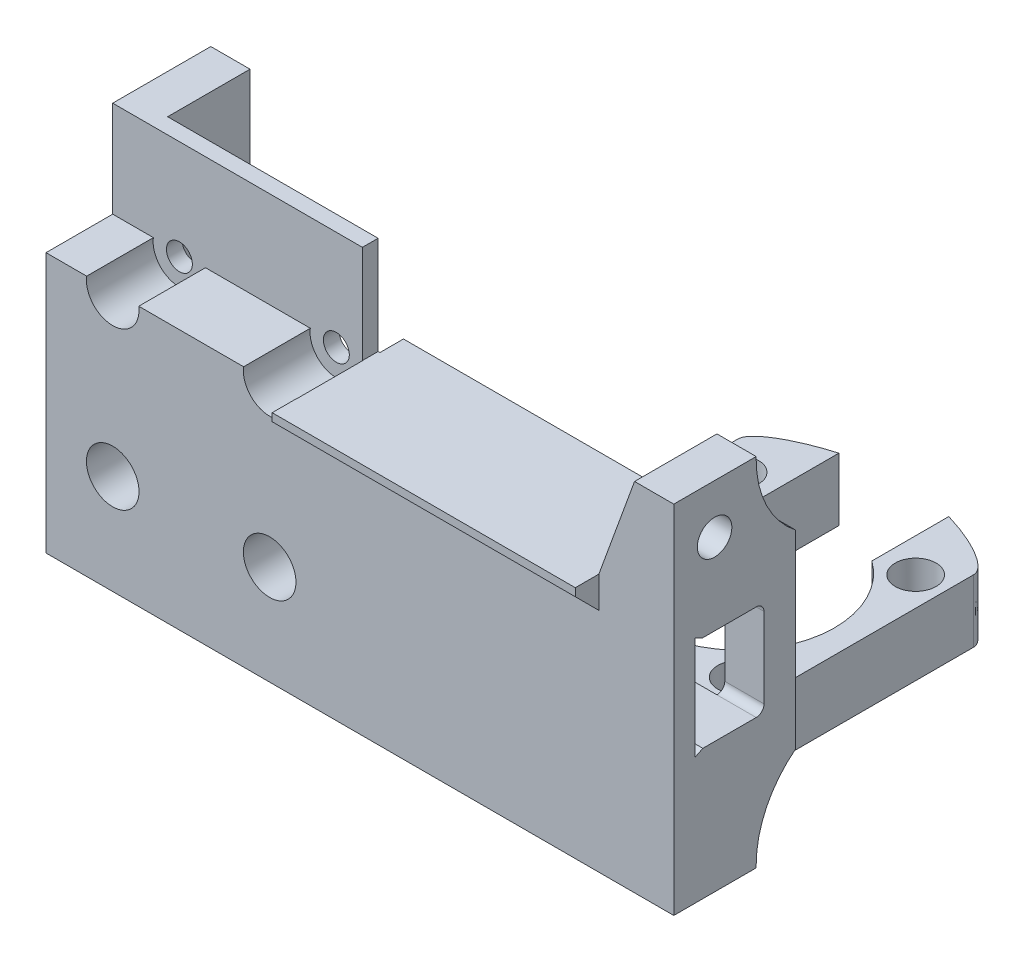
from build123d import *

# Parameters (mm, degrees)
SKETCH1_W               = 80
SKETCH1_H               = 45.4
SKETCH1_R               = 1.65
BOSS_EXTRUDE1_DEPTH     = 10.5
SKETCH2_W               = 5
SKETCH2_H               = 45.4
BOSS_EXTRUDE2_DEPTH     = 10.5
CUT_EXTRUDE1_DEPTH      = 7.8
CUT_EXTRUDE1_DEPTH_BACK = 93.58190968
SKETCH3_W               = 80
SKETCH3_H               = 12.2
SKETCH4_W               = 30
SKETCH4_H               = 8
BOSS_EXTRUDE3_DEPTH     = 44.2
SKETCH5_R               = 12
CUT_EXTRUDE2_DEPTH      = 45
CUT_EXTRUDE3_DEPTH      = 96.828388278
CUT_EXTRUDE3_DEPTH_BACK = 96.828388278
SKETCH6_R               = 2.6
FILLET1_SIZE            = 6
FILLET1_SIZE_2          = 15
SKETCH8_R               = 3.35
CUT_EXTRUDE5_DEPTH      = 8.5
SKETCH12_W              = 45
SKETCH12_H              = 12.25
CUT_EXTRUDE8_DEPTH      = 8.5
SKETCH13_W              = 14
SKETCH13_H              = 23.274164218
CUT_EXTRUDE10_DEPTH     = 10
SKETCH15_R              = 2.75
BOSS_EXTRUDE6_DEPTH     = 2
SKETCH16_W              = 43.180372268
SKETCH16_H              = 10.5
CUT_EXTRUDE11_DEPTH     = 12.5
CHAMFER2_SIZE2          = 12.5
CHAMFER2_SIZE           = 4.549627928
SKETCH17_R              = 2.2
CUT_EXTRUDE12_DEPTH     = 10
CUT_EXTRUDE13_DEPTH     = 102.559280367
SKETCH19_W              = 5
SKETCH19_H              = 24.2
BOSS_EXTRUDE7_DEPTH     = 5
SKETCH20_W              = 1
SKETCH20_H              = 12.2
CUT_EXTRUDE14_DEPTH     = 102.559280367
SKETCH21_W              = 5
SKETCH21_H              = 9.5
BOSS_EXTRUDE8_DEPTH     = 12.2
FILLET2_R               = 1
FILLET3_R               = 13
CHAMFER1_SIZE           = 2
SKETCH22_W              = 38.63074434
SKETCH22_H              = 1
BOSS_EXTRUDE9_DEPTH     = 3
SKETCH23_W              = 38.4
SKETCH23_H              = 1
BOSS_EXTRUDE10_DEPTH    = 3
CHAMFER3_SIZE           = 3


# Some blends are built 0.0001 mm under size
with BuildPart() as part:
    # Sketch1 → Boss-Extrude1 (new body)
    with BuildSketch(Plane.XY):
        with Locations((40, 22.7)):
            Rectangle(SKETCH1_W, SKETCH1_H)
        with Locations(Location((8.499989197, 32.7, 0), (0, 0, 180))):
            Circle(SKETCH1_R, mode=Mode.SUBTRACT)
        with Locations(Location((28.499989197, 32.7, 0), (0, 0, 180))):
            Circle(SKETCH1_R, mode=Mode.SUBTRACT)
        with Locations(Location((28.499989197, 12.7, 0), (0, 0, 180))):
            Circle(SKETCH1_R, mode=Mode.SUBTRACT)
        with Locations(Location((8.499989197, 12.7, 0), (0, 0, 180))):
            Circle(SKETCH1_R, mode=Mode.SUBTRACT)
    extrude(amount=BOSS_EXTRUDE1_DEPTH)

    # Sketch2 → Boss-Extrude2 (add)
    with BuildSketch(Plane(origin=(0, 0, 0), x_dir=(-1, 0, 0), z_dir=(0, 0, -1))):
        with Locations((-2.5, 22.7)):
            Rectangle(SKETCH2_W, SKETCH2_H)
    extrude(amount=BOSS_EXTRUDE2_DEPTH)

    # Sketch3 → Cut-Extrude1 (cut, two sides: drawn at the far end of the back side and taken through both)
    with BuildSketch(Plane.XY.offset(-CUT_EXTRUDE1_DEPTH_BACK)):
        with Locations((40, 22.7)):
            Rectangle(SKETCH3_W, SKETCH3_H)
    extrude(amount=CUT_EXTRUDE1_DEPTH + CUT_EXTRUDE1_DEPTH_BACK, mode=Mode.SUBTRACT)

    # Sketch4 → Boss-Extrude3 (add)
    with BuildSketch(Plane(origin=(0, 0, 0), x_dir=(-1, 0, 0), z_dir=(0, 0, -1))):
        with Locations((-54.5, 4)):
            Rectangle(SKETCH4_W, SKETCH4_H)
    extrude(amount=BOSS_EXTRUDE3_DEPTH)

    # Sketch5 → Cut-Extrude2 (cut)
    with BuildSketch(Plane(origin=(0, 8, 0), x_dir=(1, 0, 0), z_dir=(0, 1, 0))):
        with Locations(Location((54.495569327, 23.5, 0), (0, 0, 270))):
            Circle(SKETCH5_R)
    extrude(amount=-CUT_EXTRUDE2_DEPTH, mode=Mode.SUBTRACT)

    # Sketch6 → Cut-Extrude3 (cut, two sides: drawn at the far end of the back side and taken through both)
    with BuildSketch(Plane.XZ.offset(-16.6).offset(-CUT_EXTRUDE3_DEPTH_BACK)):
        with Locations((54.495569327, -39.201340103)):
            Circle(SKETCH6_R)
        with Locations((65.809277826, -34.515048602)):
            Circle(SKETCH6_R)
        with Locations((43.181860828, -34.515048602)):
            Circle(SKETCH6_R)
        with Locations((43.181860828, -11.887631605)):
            Circle(SKETCH6_R)
        with Locations((65.809277826, -11.887631605)):
            Circle(SKETCH6_R)
    extrude(amount=CUT_EXTRUDE3_DEPTH + CUT_EXTRUDE3_DEPTH_BACK, mode=Mode.SUBTRACT)

    # Fillet1
    # a fillet whose section is not a circle: 15, 6 mm, written as the material it takes off along each edge
    with BuildSketch(Plane(origin=(39.5, -37.5, -44.2), x_dir=(0, 0, 1), z_dir=(0, 1, 0)), Plane(origin=(69.5, 45.5, -44.2), x_dir=(0, 0, 1), z_dir=(0, -1, 0))) as fillet1_piece_1:
        with BuildLine():
            Bezier((FILLET1_SIZE, 0), (0, 0), (0, FILLET1_SIZE_2), weights=[1, 0.428571429, 1])
            Line((0, FILLET1_SIZE_2), (0, 0))
            Line((0, 0), (FILLET1_SIZE, 0))
        make_face()
    extrude(amount=83, mode=Mode.SUBTRACT)

    # Sketch8 → Cut-Extrude5 (cut)
    with BuildSketch(Plane.XY.offset(10.5)):
        with Locations((8.499989197, 32.7)):
            Circle(SKETCH8_R)
        with Locations((28.499989197, 32.7)):
            Circle(SKETCH8_R)
        with Locations((8.499989197, 12.7)):
            Circle(SKETCH8_R)
        with Locations((28.499989197, 12.7)):
            Circle(SKETCH8_R)
    extrude(amount=-CUT_EXTRUDE5_DEPTH, mode=Mode.SUBTRACT)

    # Sketch12 → Cut-Extrude8 (cut)
    with BuildSketch(Plane.XY.offset(10.5)):
        with Locations((22.5, 39.275)):
            Rectangle(SKETCH12_W, SKETCH12_H)
    extrude(amount=-CUT_EXTRUDE8_DEPTH, mode=Mode.SUBTRACT)

    # Sketch13 → Cut-Extrude10 (cut)
    with BuildSketch(Plane(origin=(0, 8, 0), x_dir=(1, 0, 0), z_dir=(0, 1, 0))):
        with Locations((54.495569327, 39.201340103)):
            Rectangle(SKETCH13_W, SKETCH13_H)
    extrude(amount=-CUT_EXTRUDE10_DEPTH, mode=Mode.SUBTRACT)

    # Sketch15 → Boss-Extrude6 (add)
    with BuildSketch(Plane(origin=(0, 8, 0), x_dir=(1, 0, 0), z_dir=(0, 1, 0))):
        with Locations(Location((54.495569327, 7.201340104, 0), (0, 0, 90))):
            Circle(SKETCH15_R)
    extrude(amount=BOSS_EXTRUDE6_DEPTH)

    # Sketch16 → Cut-Extrude11 (cut)
    with BuildSketch(Plane(origin=(0, 45.4, 0), x_dir=(1, 0, 0), z_dir=(0, 1, 0))):
        with Locations((53.409813866, -5.25)):
            Rectangle(SKETCH16_W, SKETCH16_H)
    extrude(amount=-CUT_EXTRUDE11_DEPTH, mode=Mode.SUBTRACT)

    # Chamfer2
    chamfer2_edges = [part.edges().sort_by_distance(p)[0] for p in [
        (75, 32.9, 5.25),
    ]]
    chamfer2_side = [part.faces().sort_by_distance(p)[0] for p in [
        (74.909007441, 32.9, 5.25),
    ]]
    chamfer(chamfer2_edges, length=CHAMFER2_SIZE - 0.0001, length2=CHAMFER2_SIZE2 - 0.0001, reference=chamfer2_side[0])  # a hair under: the kernel refuses the full size

    # Sketch17 → Cut-Extrude12 (cut)
    with BuildSketch(Plane(origin=(80, 0, 0), x_dir=(0, 0, -1), z_dir=(1, 0, 0))):
        with Locations((-5.3, 39.15)):
            Circle(SKETCH17_R)
    extrude(amount=-CUT_EXTRUDE12_DEPTH, mode=Mode.SUBTRACT)

    # Sketch18 → Cut-Extrude13 (cut, through all)
    with BuildSketch(Plane(origin=(80, 0, 0), x_dir=(0, 0, -1), z_dir=(1, 0, 0))):
        Polygon((-7.8, 28.8), (-6.8, 28.8), (-7.8, 29.3), align=None)
        Polygon((-7.8, 16.6), (-7.8, 16.1), (-6.8, 16.6), align=None)
    extrude(amount=-CUT_EXTRUDE13_DEPTH, mode=Mode.SUBTRACT)

    # Sketch19 → Boss-Extrude7 (add)
    with BuildSketch(Plane(origin=(0, 0, 0), x_dir=(-1, 0, 0), z_dir=(0, 0, -1))):
        with Locations((-77.5, 22.7)):
            Rectangle(SKETCH19_W, SKETCH19_H)
    extrude(amount=BOSS_EXTRUDE7_DEPTH)

    # Sketch20 → Cut-Extrude14 (cut, through all)
    with BuildSketch(Plane(origin=(80, 0, 0), x_dir=(0, 0, -1), z_dir=(1, 0, 0))):
        with Locations((0.5, 22.7)):
            Rectangle(SKETCH20_W, SKETCH20_H)
    extrude(amount=-CUT_EXTRUDE14_DEPTH, mode=Mode.SUBTRACT)

    # Sketch21 → Boss-Extrude8 (add)
    with BuildSketch(Plane(origin=(0, 16.6, 0), x_dir=(1, 0, 0), z_dir=(0, 1, 0))):
        with Locations((2.5, 5.75)):
            Rectangle(SKETCH21_W, SKETCH21_H)
    extrude(amount=BOSS_EXTRUDE8_DEPTH)

    # Fillet2
    fillet2_edges = [part.edges().sort_by_distance(p)[0] for p in [
        (77.5, 16.6, -1),
        (77.5, 28.8, -1),
        (2.5, 16.6, -1),
        (2.5, 28.8, -1),
    ]]
    fillet(fillet2_edges, radius=FILLET2_R)

    # Fillet3
    # the kernel refuses this fillet: 13 mm, written as the material it adds along each edge
    with BuildSketch(Plane(origin=(80, 10.6, 0), x_dir=(0, -1, 0), z_dir=(-1, 0, 0)), Plane(origin=(75, 34.8, 0), x_dir=(0, 1, 0), z_dir=(1, 0, 0))) as fillet3_piece_1:
        with BuildLine():
            CenterArc((10.246950766, -13), FILLET3_R, 90, 52.020127555)
            Line((0, -5), (0, 0))
            Line((0, 0), (10.246950766, 0))
        make_face()
    extrude(amount=5)

    # Chamfer1
    chamfer1_edges = [part.edges().sort_by_distance(p)[0] for p in [
        (54.495569327, 10, -4.451340104),
    ]]
    chamfer(chamfer1_edges, length=CHAMFER1_SIZE - 0.0001)  # a hair under: the kernel refuses the full size

    # Sketch22 → Boss-Extrude9 (add)
    with BuildSketch(Plane.XY.offset(10.5)):
        with Locations((51.134999902, 32.4)):
            Rectangle(SKETCH22_W, SKETCH22_H)
    extrude(amount=BOSS_EXTRUDE9_DEPTH)

    # Sketch23 → Boss-Extrude10 (add)
    with BuildSketch(Plane(origin=(0, 0, 0), x_dir=(-1, 0, 0), z_dir=(0, 0, -1))):
        with Locations((-51.250372072, 32.4)):
            Rectangle(SKETCH23_W, SKETCH23_H)
    extrude(amount=BOSS_EXTRUDE10_DEPTH)

    # Chamfer3
    chamfer3_edges = [part.edges().sort_by_distance(p)[0] for p in [
        (51.134999902, 31.9, 10.5),
        (51.250372072, 31.9, 0),
    ]]
    chamfer(chamfer3_edges, length=CHAMFER3_SIZE - 0.0001)  # a hair under: the kernel refuses the full size


solid = part.part
